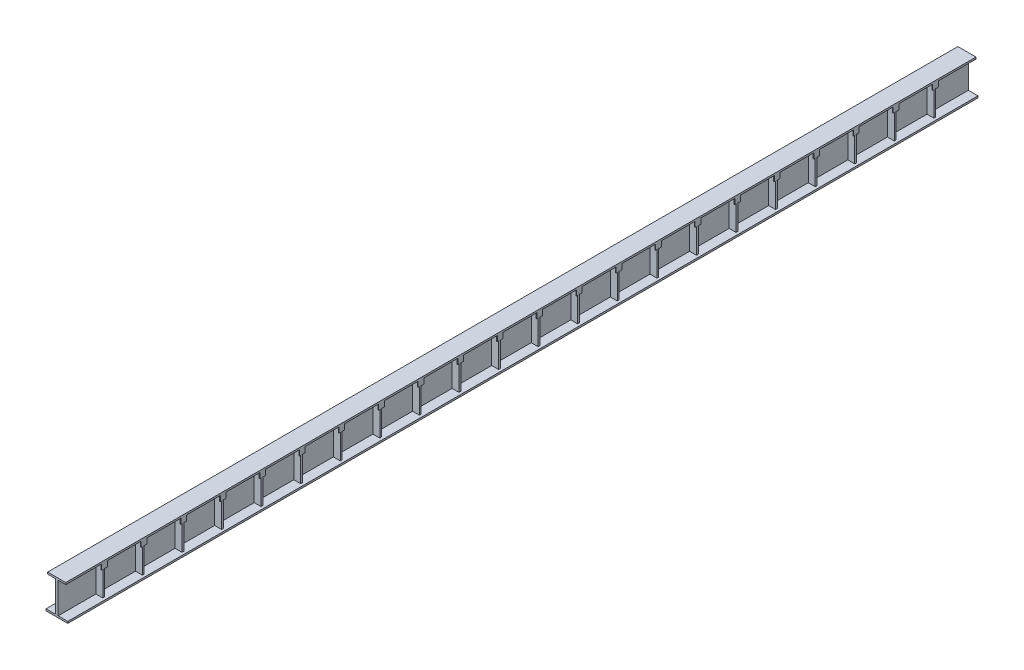
from build123d import *

# Parameters (mm, degrees)
BOSS_EXTRUDE2_DEPTH   = 25.1
SKETCH2_W             = 0.05
SKETCH2_H             = 0.85
BOSS_EXTRUDE3_DEPTH   = 0.19
SKETCH4_W             = 0.156098414
SKETCH4_H             = 0.15
BOSS_EXTRUDE4_DEPTH   = 0.02
LPATTERN4_START       = 0.04
LPATTERN4_OUTLINE_W   = 0.85
LPATTERN4_OUTLINE_H   = 0.05
LPATTERN4_DEPTH       = 0.19
LPATTERN4_START_2     = 0.23
LPATTERN4_2_OUTLINE_W = 0.15
LPATTERN4_2_OUTLINE_H = 0.156098414
LPATTERN4_2_DEPTH     = 0.02
SCALE1_SCALE          = 1000


# Read off the part's stored shape, not the designer's step: LPattern4
with BuildPart() as part:
    # Sketch1 → Boss-Extrude2 (new body)
    with BuildSketch(Plane.XY):
        Polygon((-0.0375, 0), (-0.0375, 0.45), (-0.25, 0.45), (-0.25, 0.5), (0, 0.5), (0.25, 0.5), (0.25, 0.45), (0.04, 0.45), (0.04, -0.4), (0.304777515, -0.4), (0.304777515, -0.45), (-0.295222485, -0.45), (-0.295222485, -0.4), (-0.0375, -0.4), align=None)
    extrude(amount=BOSS_EXTRUDE2_DEPTH)

    # Sketch2 → Boss-Extrude3 (add)
    with BuildSketch(Plane(origin=(0.04, 0, 0), x_dir=(0, 0, -1), z_dir=(1, 0, 0))):
        with Locations((-1.116304348, 0.025)):
            Rectangle(SKETCH2_W, SKETCH2_H)
    extrude(amount=BOSS_EXTRUDE3_DEPTH)

    # Sketch4 → Boss-Extrude4 (add)
    with BuildSketch(Plane(origin=(0.23, 0, 0), x_dir=(0, 0, -1), z_dir=(1, 0, 0))):
        with Locations((-1.116304348, 0.375)):
            Rectangle(SKETCH4_W, SKETCH4_H)
    extrude(amount=BOSS_EXTRUDE4_DEPTH)

    # LPattern4 outline → LPattern4 (add)
    with BuildSketch(Plane.YZ.offset(LPATTERN4_START)):
        with Locations((0.025, 2.207608348)):
            Rectangle(LPATTERN4_OUTLINE_W, LPATTERN4_OUTLINE_H)
        with Locations((0.025, 3.298912348)):
            Rectangle(LPATTERN4_OUTLINE_W, LPATTERN4_OUTLINE_H)
        with Locations((0.025, 4.390216348)):
            Rectangle(LPATTERN4_OUTLINE_W, LPATTERN4_OUTLINE_H)
        with Locations((0.025, 5.481520348)):
            Rectangle(LPATTERN4_OUTLINE_W, LPATTERN4_OUTLINE_H)
        with Locations((0.025, 6.572824348)):
            Rectangle(LPATTERN4_OUTLINE_W, LPATTERN4_OUTLINE_H)
        with Locations((0.025, 7.664128348)):
            Rectangle(LPATTERN4_OUTLINE_W, LPATTERN4_OUTLINE_H)
        with Locations((0.025, 8.755432348)):
            Rectangle(LPATTERN4_OUTLINE_W, LPATTERN4_OUTLINE_H)
        with Locations((0.025, 9.846736348)):
            Rectangle(LPATTERN4_OUTLINE_W, LPATTERN4_OUTLINE_H)
        with Locations((0.025, 10.938040348)):
            Rectangle(LPATTERN4_OUTLINE_W, LPATTERN4_OUTLINE_H)
        with Locations((0.025, 12.029344348)):
            Rectangle(LPATTERN4_OUTLINE_W, LPATTERN4_OUTLINE_H)
        with Locations((0.025, 13.120648348)):
            Rectangle(LPATTERN4_OUTLINE_W, LPATTERN4_OUTLINE_H)
        with Locations((0.025, 14.211952348)):
            Rectangle(LPATTERN4_OUTLINE_W, LPATTERN4_OUTLINE_H)
        with Locations((0.025, 15.303256348)):
            Rectangle(LPATTERN4_OUTLINE_W, LPATTERN4_OUTLINE_H)
        with Locations((0.025, 16.394560348)):
            Rectangle(LPATTERN4_OUTLINE_W, LPATTERN4_OUTLINE_H)
        with Locations((0.025, 17.485864348)):
            Rectangle(LPATTERN4_OUTLINE_W, LPATTERN4_OUTLINE_H)
        with Locations((0.025, 18.577168348)):
            Rectangle(LPATTERN4_OUTLINE_W, LPATTERN4_OUTLINE_H)
        with Locations((0.025, 19.668472348)):
            Rectangle(LPATTERN4_OUTLINE_W, LPATTERN4_OUTLINE_H)
        with Locations((0.025, 20.759776348)):
            Rectangle(LPATTERN4_OUTLINE_W, LPATTERN4_OUTLINE_H)
        with Locations((0.025, 21.851080348)):
            Rectangle(LPATTERN4_OUTLINE_W, LPATTERN4_OUTLINE_H)
        with Locations((0.025, 22.942384348)):
            Rectangle(LPATTERN4_OUTLINE_W, LPATTERN4_OUTLINE_H)
        with Locations((0.025, 24.033688348)):
            Rectangle(LPATTERN4_OUTLINE_W, LPATTERN4_OUTLINE_H)
    extrude(amount=LPATTERN4_DEPTH)

    # LPattern4 2 outline → LPattern4 2 (add)
    with BuildSketch(Plane.YZ.offset(LPATTERN4_START_2)):
        with Locations((0.375, 2.207608348)):
            Rectangle(LPATTERN4_2_OUTLINE_W, LPATTERN4_2_OUTLINE_H)
        with Locations((0.375, 3.298912348)):
            Rectangle(LPATTERN4_2_OUTLINE_W, LPATTERN4_2_OUTLINE_H)
        with Locations((0.375, 4.390216348)):
            Rectangle(LPATTERN4_2_OUTLINE_W, LPATTERN4_2_OUTLINE_H)
        with Locations((0.375, 5.481520348)):
            Rectangle(LPATTERN4_2_OUTLINE_W, LPATTERN4_2_OUTLINE_H)
        with Locations((0.375, 6.572824348)):
            Rectangle(LPATTERN4_2_OUTLINE_W, LPATTERN4_2_OUTLINE_H)
        with Locations((0.375, 7.664128348)):
            Rectangle(LPATTERN4_2_OUTLINE_W, LPATTERN4_2_OUTLINE_H)
        with Locations((0.375, 8.755432348)):
            Rectangle(LPATTERN4_2_OUTLINE_W, LPATTERN4_2_OUTLINE_H)
        with Locations((0.375, 9.846736348)):
            Rectangle(LPATTERN4_2_OUTLINE_W, LPATTERN4_2_OUTLINE_H)
        with Locations((0.375, 10.938040348)):
            Rectangle(LPATTERN4_2_OUTLINE_W, LPATTERN4_2_OUTLINE_H)
        with Locations((0.375, 12.029344348)):
            Rectangle(LPATTERN4_2_OUTLINE_W, LPATTERN4_2_OUTLINE_H)
        with Locations((0.375, 13.120648348)):
            Rectangle(LPATTERN4_2_OUTLINE_W, LPATTERN4_2_OUTLINE_H)
        with Locations((0.375, 14.211952348)):
            Rectangle(LPATTERN4_2_OUTLINE_W, LPATTERN4_2_OUTLINE_H)
        with Locations((0.375, 15.303256348)):
            Rectangle(LPATTERN4_2_OUTLINE_W, LPATTERN4_2_OUTLINE_H)
        with Locations((0.375, 16.394560348)):
            Rectangle(LPATTERN4_2_OUTLINE_W, LPATTERN4_2_OUTLINE_H)
        with Locations((0.375, 17.485864348)):
            Rectangle(LPATTERN4_2_OUTLINE_W, LPATTERN4_2_OUTLINE_H)
        with Locations((0.375, 18.577168348)):
            Rectangle(LPATTERN4_2_OUTLINE_W, LPATTERN4_2_OUTLINE_H)
        with Locations((0.375, 19.668472348)):
            Rectangle(LPATTERN4_2_OUTLINE_W, LPATTERN4_2_OUTLINE_H)
        with Locations((0.375, 20.759776348)):
            Rectangle(LPATTERN4_2_OUTLINE_W, LPATTERN4_2_OUTLINE_H)
        with Locations((0.375, 21.851080348)):
            Rectangle(LPATTERN4_2_OUTLINE_W, LPATTERN4_2_OUTLINE_H)
        with Locations((0.375, 22.942384348)):
            Rectangle(LPATTERN4_2_OUTLINE_W, LPATTERN4_2_OUTLINE_H)
        with Locations((0.375, 24.033688348)):
            Rectangle(LPATTERN4_2_OUTLINE_W, LPATTERN4_2_OUTLINE_H)
    extrude(amount=LPATTERN4_2_DEPTH)


with BuildPart() as part_1:
    # Scale1: scaled about (0.009969116, 0.008590775, 12.551458178)
    add(part.part.scale(SCALE1_SCALE).moved(Location((-9.959146884, -8.582184225, -12538.906719822))))


solid = part_1.part
